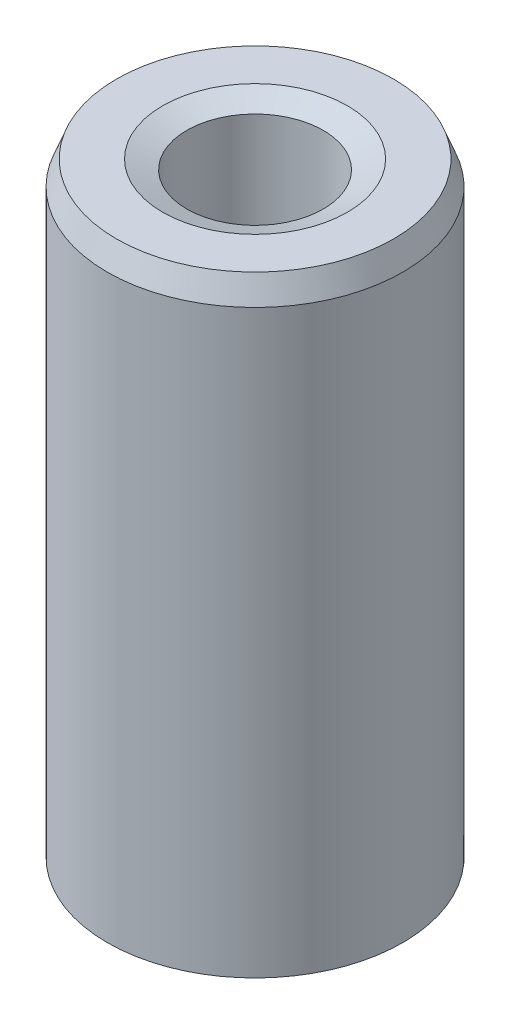
from build123d import *
from OCP.BRepFilletAPI import BRepFilletAPI_MakeChamfer

# Parameters (mm, degrees)
SKETCH1_R           = 12.5
BOSS_EXTRUDE1_DEPTH = 51.934832669
SKETCH2_R           = 5.769714936
CUT_EXTRUDE1_DEPTH  = 55.860977428
CHAMFER1_SIZE       = 2.038761076
CHAMFER1_SIZE2      = 0.783218615


with BuildPart() as part:
    # Sketch1 → Boss-Extrude1 (new body)
    with BuildSketch(Plane(origin=(0, 0, 0), x_dir=(1, 0, 0), z_dir=(0, 1, 0))):
        Circle(SKETCH1_R)
    extrude(amount=BOSS_EXTRUDE1_DEPTH)

    # Sketch2 → Cut-Extrude1 (cut, through all)
    with BuildSketch(Plane(origin=(0, 0, 0), x_dir=(1, 0, 0), z_dir=(0, 1, 0))):
        Circle(SKETCH2_R)
    extrude(amount=CUT_EXTRUDE1_DEPTH, mode=Mode.SUBTRACT)

    # Chamfer1: one chamfer whose edges measure the first distance from different faces: ONE call of the kernel's chamfer builder (chamfer() names one face for all edges)
    chamfer1_edges_1 = [part.edges().sort_by_distance(p)[0] for p in [
        (-5.769714936, 51.934832669, 0),
    ]]
    chamfer1_side_1 = [part.faces().sort_by_distance(p)[0] for p in [
        (-12.146446609, 51.934832669, 0),
    ]]
    chamfer1_edges_2 = [part.edges().sort_by_distance(p)[0] for p in [
        (-5.769714936, 0, 0),
    ]]
    chamfer1_side_2 = [part.faces().sort_by_distance(p)[0] for p in [
        (-5.769714936, 25.967416334, 0),
    ]]
    chamfer1_edges_3 = [part.edges().sort_by_distance(p)[0] for p in [
        (-12.5, 0, 0),
    ]]
    chamfer1_side_3 = [part.faces().sort_by_distance(p)[0] for p in [
        (-12.146446609, 0, 0),
    ]]
    chamfer1_edges_4 = [part.edges().sort_by_distance(p)[0] for p in [
        (-12.5, 51.934832669, 0),
    ]]
    chamfer1_side_4 = [part.faces().sort_by_distance(p)[0] for p in [
        (-12.5, 25.967416334, 0),
    ]]
    chamfer1 = BRepFilletAPI_MakeChamfer(part.part.solid().wrapped)
    for e in chamfer1_edges_1:
        chamfer1.Add(CHAMFER1_SIZE, CHAMFER1_SIZE2, e.wrapped, chamfer1_side_1[0].wrapped)  # the first distance lies on this face
    for e in chamfer1_edges_2:
        chamfer1.Add(CHAMFER1_SIZE, CHAMFER1_SIZE2, e.wrapped, chamfer1_side_2[0].wrapped)  # the first distance lies on this face
    for e in chamfer1_edges_3:
        chamfer1.Add(CHAMFER1_SIZE, CHAMFER1_SIZE2, e.wrapped, chamfer1_side_3[0].wrapped)  # the first distance lies on this face
    for e in chamfer1_edges_4:
        chamfer1.Add(CHAMFER1_SIZE, CHAMFER1_SIZE2, e.wrapped, chamfer1_side_4[0].wrapped)  # the first distance lies on this face
    add(Compound.cast(chamfer1.Shape()), mode=Mode.REPLACE)


solid = part.part
